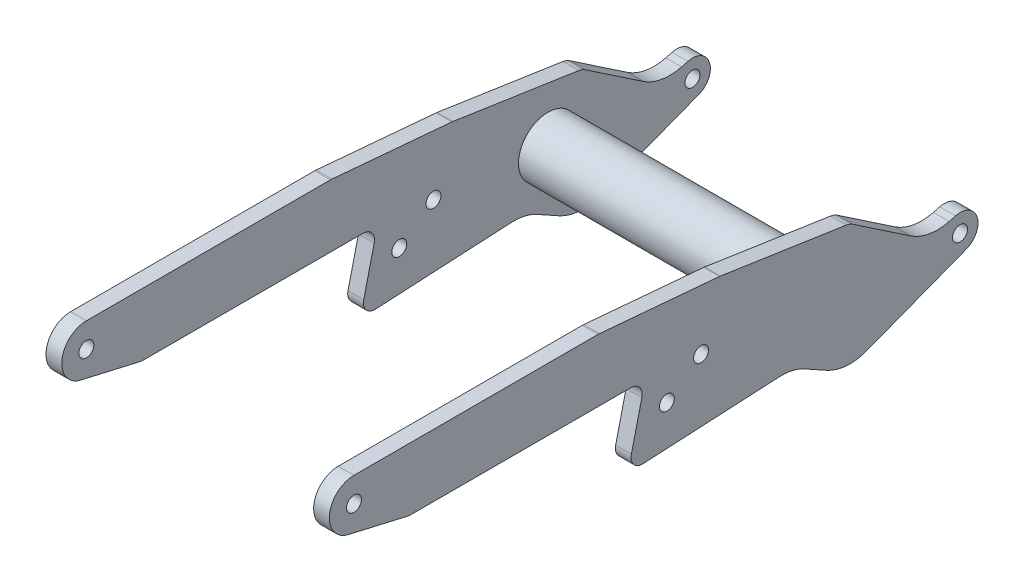
from build123d import *

# Parameters (mm, degrees)
SKETCH1_R           = 4.75
BOSS_EXTRUDE1_DEPTH = 90
FILLET1_R           = 10
SKETCH4_W           = 160
SKETCH4_H           = 412.025
CUT_EXTRUDE2_DEPTH  = 418.739316622
SKETCH5_R           = 18.75
BOSS_EXTRUDE3_DEPTH = 90


with BuildPart() as part:
    # Sketch1 → Boss-Extrude1 (new, symmetric)
    with BuildSketch(Plane(origin=(0, 0, 0), x_dir=(0, 0, -1), z_dir=(1, 0, 0))):
        with BuildLine():
            Line((0, 15.625), (155.5, 15.625))
            Line((155.5, 15.625), (232.5, 8.888372909))
            Line((232.5, 8.888372909), (315, -3.441334703))
            Line((315, -3.441334703), (353.780445284, -29.599075334))
            ThreePointArc((353.780445284, -29.599075334), (365.491486019, -34.297330028), (378.098548324, -33.764364436))
            Line((378.098548324, -33.764364436), (382.133919944, -32.716161814))
            ThreePointArc((382.133919944, -32.716161814), (395.855263955, -40.268155018), (389.086597054, -54.392355215))
            Line((389.086597054, -54.392355215), (325.840301311, -78.678532537))
            ThreePointArc((325.840301311, -78.678532537), (312.996785566, -80.599492359), (300.544774533, -76.912568905))
            Line((300.544774533, -76.912568905), (286.274266107, -69.004404506))
            ThreePointArc((286.274266107, -69.004404506), (278.478171078, -66.012774583), (270.159478586, -65.285930348))
            Line((270.159478586, -65.285930348), (183.644750078, -69.829776728))
            ThreePointArc((183.644750078, -69.829776728), (177.69334539, -67.229235713), (176.212855636, -60.905456668))
            Line((176.212855636, -60.905456668), (182.866024409, -33.050687222))
            ThreePointArc((182.866024409, -33.050687222), (181.505326746, -26.874655225), (175.81438365, -24.116388374))
            Line((175.81438365, -24.116388374), (35, -24.116388374))
            Line((35, -24.116388374), (-3.514860224, -15.224532262))
            ThreePointArc((-3.514860224, -15.224532262), (-15.524560245, 1.768800215), (0, 15.625))
        make_face()
        with Locations(Location((0, 0, 0), (0, 0, 180))):
            Circle(SKETCH1_R, mode=Mode.SUBTRACT)
        with Locations(Location((198.75, -43.75, 0), (0, 0, 180))):
            Circle(SKETCH1_R, mode=Mode.SUBTRACT)
        with Locations(Location((220.5, -28, 0), (0, 0, 180))):
            Circle(SKETCH1_R, mode=Mode.SUBTRACT)
        with Locations(Location((385, -43.75, 0), (0, 0, 180))):
            Circle(SKETCH1_R, mode=Mode.SUBTRACT)
    extrude(amount=BOSS_EXTRUDE1_DEPTH, both=True)

    # Fillet1
    # the kernel refuses this fillet: 10 mm, written as the material it takes off along each edge
    with BuildSketch(Plane(origin=(91.091523573, 15.625, -155.5), x_dir=(0, 0, 1), z_dir=(-1, 0, 0))) as fillet1_piece_1:
        with BuildLine():
            CenterArc((FILLET1_R * 0.0436609429085, -FILLET1_R), FILLET1_R, 90, 5)
            Line((-FILLET1_R * 0.0434947998391, -FILLET1_R * 0.00380530190825), (0, 0))
            Line((0, 0), (FILLET1_R * 0.0436609429085, 0))
        make_face()
    extrude(amount=182.183047145, mode=Mode.SUBTRACT)
    with BuildSketch(Plane(origin=(90.763819082, 8.888372909, -232.5), x_dir=(0, -0.14780941112960186, -0.989015863361918), z_dir=(-1, 0, 0))) as fillet1_piece_2:
        with BuildLine():
            CenterArc((FILLET1_R * 0.0305527632986, FILLET1_R), FILLET1_R, 266.5, 3.5)
            Line((-FILLET1_R * 0.0304957762363, FILLET1_R * 0.00186520157813), (0, 0))
            Line((0, 0), (FILLET1_R * 0.0305527632986, 0))
        make_face()
    extrude(amount=181.527638165, mode=Mode.SUBTRACT)
    with BuildSketch(Plane(origin=(95.656922456, -3.441334703, -315), x_dir=(0, -0.5591929034707496, -0.8290375725550397), z_dir=(-1, 0, 0))) as fillet1_piece_3:
        with BuildLine():
            CenterArc((FILLET1_R * 0.226276898255, FILLET1_R), FILLET1_R, 244.5, 25.5)
            Line((-FILLET1_R * 0.204234198553, FILLET1_R * 0.0974147156501), (0, 0))
            Line((0, 0), (FILLET1_R * 0.226276898255, 0))
        make_face()
    extrude(amount=191.313844913, mode=Mode.SUBTRACT)
    with BuildSketch(Plane(origin=(-92.848390208, -24.116388374, -35), x_dir=(0, 0.2249510543438657, 0.9743700647852351), z_dir=(1, 0, 0))) as fillet1_piece_4:
        with BuildLine():
            CenterArc((FILLET1_R * 0.113935608302, -FILLET1_R), FILLET1_R, 90, 13)
            Line((-FILLET1_R * 0.111015446042, -FILLET1_R * 0.0256299352148), (0, 0))
            Line((0, 0), (FILLET1_R * 0.113935608302, 0))
        make_face()
    extrude(amount=185.696780415, mode=Mode.SUBTRACT)

    # Sketch4 → Cut-Extrude2 (cut, through all)
    with BuildSketch(Plane(origin=(0, 15.625, 0), x_dir=(1, 0, 0), z_dir=(0, 1, 0))):
        with Locations((0, 190.3875)):
            Rectangle(SKETCH4_W, SKETCH4_H)
    extrude(amount=-CUT_EXTRUDE2_DEPTH, mode=Mode.SUBTRACT)


with BuildPart() as cut_extrude2_piece_1:
    # of the separate pieces the step leaves, piece 1, a body of its own (cut_extrude2_pieces)
    add(part.part.solids().sort_by_distance((80, 15.625, 0))[0])



with BuildPart() as cut_extrude2_piece_2:
    # of the separate pieces the step leaves, piece 2, a body of its own (cut_extrude2_pieces)
    add(part.part.solids().sort_by_distance((-90, 15.625, 0))[0])


with BuildPart() as cut_extrude2_piece_1_1:
    add(cut_extrude2_piece_1.part)

    add(cut_extrude2_piece_2.part)  # Boss-Extrude3 merges Cut-Extrude2 piece 2
    # Sketch5 → Boss-Extrude3 (add, symmetric)
    with BuildSketch(Plane(origin=(0, 0, 0), x_dir=(0, 0, -1), z_dir=(1, 0, 0))):
        with Locations(Location((293.25, -35, 0), (0, 0, 180))):
            Circle(SKETCH5_R)
    extrude(amount=BOSS_EXTRUDE3_DEPTH, both=True)


solid = cut_extrude2_piece_1_1.part
